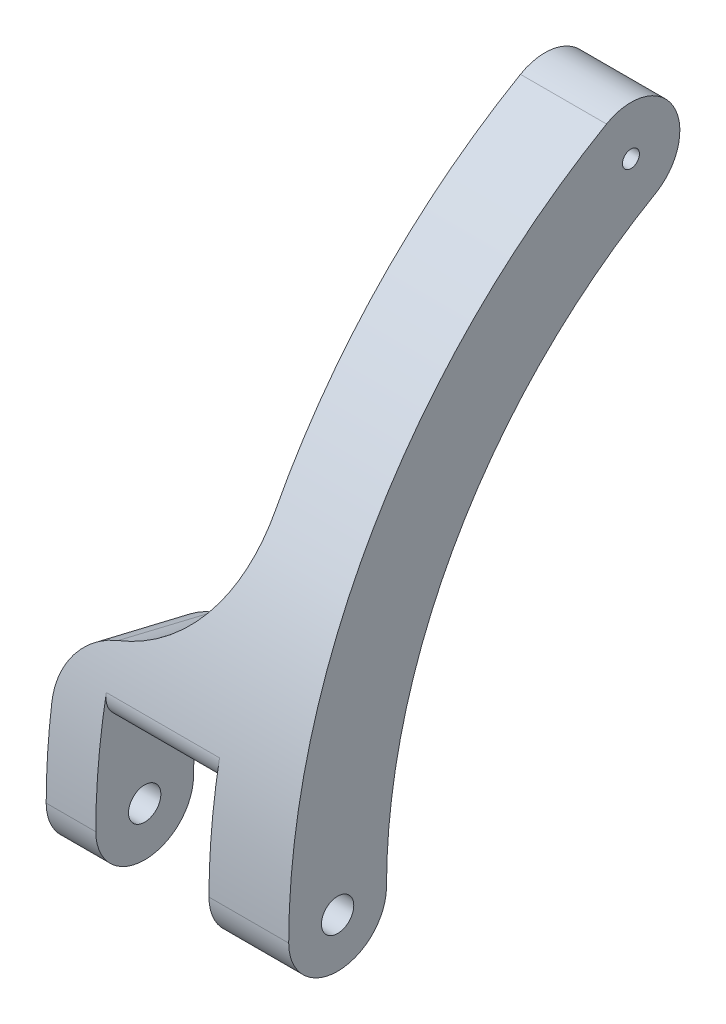
from build123d import *

# Parameters (mm, degrees)
ESQUISSE1_R                  = 1.050000000000002
ESQUISSE1_R_2                = 0.5500000000000002
BOSS_EXTRU_1_DEPTH           = 5.588
BOSS_EXTRU_2_START           = 10.16
BOSS_EXTRU_2_DEPTH           = 10.16
ESQUISSE3_W                  = 7.349999
ESQUISSE3_H                  = 12.302264747859223
ENL_V_MAT_EXTRU_1_DEPTH      = 5.715
CONG_1_R                     = 10.16
CONG_2_R                     = 5.08
ENL_V_MAT_EXTRU_2_DEPTH      = 58.09584154270072
ENL_V_MAT_EXTRU_2_DEPTH_BACK = 58.09584154270072
ESQUISSE4_R                  = 1.050000000000002
CONG_3_R                     = 1.5


with BuildPart() as part:
    # Esquisse1 → Boss.-Extru.1 (new body)
    with BuildSketch(Plane(origin=(0, 0, 0), x_dir=(0, 0, -1), z_dir=(1, 0, 0))):
        with BuildLine():
            ThreePointArc((-34.925000000000004, 0), (-30.245937227171517, 17.462500000000013), (-17.4625, 30.245937227171524))
            ThreePointArc((-17.4625, 30.245937227171524), (-16.300369342984403, 34.583067884187116), (-20.637499999999996, 35.745198541202704))
            ThreePointArc((-20.637499999999996, 35.745198541202704), (-35.7451985412027, 20.637500000000014), (-41.275, 0))
            ThreePointArc((-41.275, 0), (-38.1, -3.174999999999997), (-34.925000000000004, 0))
        make_face()
        with Locations((-38.1, 0)):
            Circle(ESQUISSE1_R, mode=Mode.SUBTRACT)
        with Locations((-19.049999999999997, 32.99556788418712)):
            Circle(ESQUISSE1_R_2, mode=Mode.SUBTRACT)
    extrude(amount=BOSS_EXTRU_1_DEPTH)

    # Esquisse2 → Boss.-Extru.2 (add)
    with BuildSketch(Plane.ZY.offset(BOSS_EXTRU_2_START)):
        with BuildLine():
            Line((40.13567832123378, 9.630833333333326), (33.96095857950552, 8.14916666666666))
            ThreePointArc((33.96095857950552, 8.14916666666666), (34.68315227447781, 4.10299565017866), (34.925000000000004, 0))
            ThreePointArc((34.925000000000004, 0), (38.1, -3.174999999999997), (41.275, 0))
            ThreePointArc((41.275, 0), (40.9891799607465, 4.848994859302054), (40.13567832123378, 9.630833333333326))
        make_face()
    extrude(amount=-BOSS_EXTRU_2_DEPTH)

    # Esquisse3 → Enlèv. mat.-Extru.1 (cut, symmetric)
    with BuildSketch(Plane(origin=(0, 0, 0), x_dir=(1, 0, 0), z_dir=(0, 1, 0))):
        with Locations((-3.2647804999577055, -37.13499681447274)):
            Rectangle(ESQUISSE3_W, ESQUISSE3_H)
    extrude(amount=ENL_V_MAT_EXTRU_1_DEPTH, both=True, mode=Mode.SUBTRACT)

    # Congé1
    cong_1_edges = [part.edges().sort_by_distance(p)[0] for p in [
        (0, 8.889999999999993, 37.04831845036965),
    ]]
    fillet(cong_1_edges, radius=CONG_1_R - 0.0001)  # a hair under: the kernel refuses the full size

    # Congé2
    cong_2_edges = [part.edges().sort_by_distance(p)[0] for p in [
        (-10.16, 8.889999999999993, 37.04831845036965),
    ]]
    fillet(cong_2_edges, radius=CONG_2_R)

    # Esquisse4 → Enlèv. mat.-Extru.2 (cut, two sides: drawn at the far end of the back side and taken through both)
    with BuildSketch(Plane(origin=(5.588, 0, 0), x_dir=(0, 0, -1), z_dir=(1, 0, 0)).offset(-ENL_V_MAT_EXTRU_2_DEPTH_BACK)):
        with Locations(Location((-38.10000264654745, -3.51466647443e-06, 0), (0, 0, 0.000191786))):
            Circle(ESQUISSE4_R)
    extrude(amount=ENL_V_MAT_EXTRU_2_DEPTH + ENL_V_MAT_EXTRU_2_DEPTH_BACK, mode=Mode.SUBTRACT)

    # Congé3
    cong_3_edges = [part.edges().sort_by_distance(p)[0] for p in [
        (-3.2647804999577055, 5.715, 40.87743142615494),
        (-3.2647804999577055, 5.715, 34.45423631427637),
    ]]
    fillet(cong_3_edges, radius=CONG_3_R)


solid = part.part
